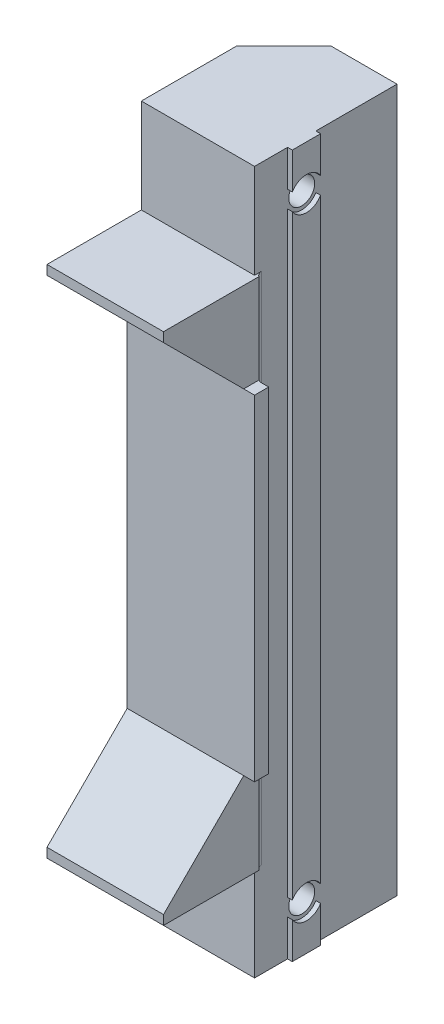
from build123d import *
from build123d.topology import SkipClean

# Parameters (mm, degrees)
BOSS_EXTRUDE1_DEPTH            = 7.2
SKETCH2_R                      = 1.1
CUT_EXTRUDE1_DEPTH             = 99.880748885
SKETCH3_R                      = 2.25
CUT_EXTRUDE2_DEPTH             = 5.5
BOSS_EXTRUDE2_DEPTH            = 3
FILLET1_R                      = 11
BOSS_EXTRUDE3_DEPTH            = 43
BOSS_EXTRUDE4_DEPTH            = 30
FILLET2_R                      = 1.5
SKETCH7_R                      = 2.75
CUT_EXTRUDE3_DEPTH             = 179.693144804
SKETCH8_R                      = 5.25
CUT_EXTRUDE4_DEPTH             = 5
CUT_EXTRUDE6_START             = -2.5
SKETCH10_R                     = 5.25
CUT_EXTRUDE6_DEPTH             = 2.5
CHAMFER1_SIZE                  = 2.5
CUT_EXTRUDE5_REACH             = 170.548
SKETCH9_R                      = 3.5
CUT_EXTRUDE5_DIRECTION_2_REACH = 170.548
CUT_EXTRUDE7_DEPTH             = 105.056727317
CUT_EXTRUDE8_DEPTH             = 20
BOSS_EXTRUDE6_DEPTH            = 17
SKETCH15_R                     = 5.25
BOSS_EXTRUDE7_DEPTH            = 10
CHAMFER3_SIZE                  = 10
BOSS_EXTRUDE5_DEPTH            = 17.55
SKETCH16_W                     = 1.5
SKETCH16_H                     = 19
CUT_EXTRUDE9_DEPTH             = 2.3
BOSS_EXTRUDE8_DEPTH            = 4
BOSS_EXTRUDE9_DEPTH            = 31.5


with BuildPart() as part:
    # Sketch1 → Boss-Extrude1 (new body)
    with BuildSketch(Plane.XY):
        Polygon((74.75, 0), (-74.75, 0), (-74.75, 30), (-88.75, 30), (-88.75, -13), (84.25, -13), (84.25, 17), (74.75, 17), align=None)
    extrude(amount=BOSS_EXTRUDE1_DEPTH)

    # Sketch2 → Cut-Extrude1 (cut, through all)
    with BuildSketch(Plane.XZ.offset(13)):
        with Locations(Location((-56.25, 4.5, 0), (0, 0, 270))):
            Circle(SKETCH2_R)
        with Locations(Location((37.75, 4.5, 0), (0, 0, 270))):
            Circle(SKETCH2_R)
    extrude(amount=-CUT_EXTRUDE1_DEPTH, mode=Mode.SUBTRACT)

    # Sketch3 → Cut-Extrude2 (cut)
    with BuildSketch(Plane.XZ.offset(13)):
        with Locations(Location((-56.25, 4.5, 0), (0, 0, 270))):
            Circle(SKETCH3_R)
        with Locations(Location((37.75, 4.5, 0), (0, 0, 270))):
            Circle(SKETCH3_R)
    extrude(amount=-CUT_EXTRUDE2_DEPTH, mode=Mode.SUBTRACT)

    # Sketch4 → Boss-Extrude2 (add)
    with BuildSketch(Plane.XY.offset(7.2)):
        Polygon((-88.75, -13), (84.25, -13), (84.25, 2.989373151), (84.25, 17), (74.75, 17), (74.75, 6), (-74.75, 6), (-74.75, 30), (-88.75, 30), align=None)
    extrude(amount=BOSS_EXTRUDE2_DEPTH)

    # Fillet1
    fillet1_edges = [part.edges().sort_by_distance(p)[0] for p in [
        (74.75, 6, 8.7),
        (-74.75, 6, 8.7),
    ]]
    fillet(fillet1_edges, radius=FILLET1_R - 0.0001)  # a hair under: the kernel refuses the full size

    # Sketch5 → Boss-Extrude3 (add)
    with BuildSketch(Plane.XZ.offset(13)):
        Polygon((-74.75, 30.2), (-71.75, 30.2), (-71.75, 33.2), (-88.75, 33.2), (-88.75, 10.2), (-74.75, 10.2), (-74.75, 17.2), (-73.75, 17.2), (-73.75, 23.2), (-74.75, 23.2), align=None)
    extrude(amount=-BOSS_EXTRUDE3_DEPTH)

    # Sketch6 → Boss-Extrude4 (add)
    with BuildSketch(Plane.XZ.offset(13)):
        Polygon((74.75, 10.2), (74.75, 17.2), (73.75, 17.2), (73.75, 23.2), (74.75, 23.2), (74.75, 30.2), (71.75, 30.2), (71.75, 33.2), (84.25, 33.2), (84.25, 10.2), align=None)
    extrude(amount=-BOSS_EXTRUDE4_DEPTH)

    # Fillet2
    fillet2_edges = [part.edges().sort_by_distance(p)[0] for p in [
        (74.75, 1.99995, 10.2),
        (74.75, 2, 30.2),
        (-74.75, 1.99995, 10.2),
        (-74.75, 8.5, 30.2),
    ]]
    fillet(fillet2_edges, radius=FILLET2_R)

    # Sketch7 → Cut-Extrude3 (cut, through all)
    with BuildSketch(Plane(origin=(84.25, 0, 0), x_dir=(0, 0, -1), z_dir=(1, 0, 0))):
        with Locations((-20.2, -3.5)):
            Circle(SKETCH7_R)
    extrude(amount=-CUT_EXTRUDE3_DEPTH, mode=Mode.SUBTRACT)

    # Sketch8 → Cut-Extrude4 (cut)
    with BuildSketch(Plane(origin=(84.25, 0, 0), x_dir=(0, 0, -1), z_dir=(1, 0, 0))):
        with Locations((-20.2, -3.5)):
            Circle(SKETCH8_R)
    extrude(amount=-CUT_EXTRUDE4_DEPTH, mode=Mode.SUBTRACT)

    # Sketch10 → Cut-Extrude6 (cut)
    with BuildSketch(Plane.ZY.offset(88.75).offset(CUT_EXTRUDE6_START)):
        with Locations(Location((20.2, -3.5, 0), (0, 0, 180))):
            Circle(SKETCH10_R)
    extrude(amount=CUT_EXTRUDE6_DEPTH, mode=Mode.SUBTRACT)

    # Chamfer1
    chamfer1_edges = [part.edges().sort_by_distance(p)[0] for p in [
        (79.25, -3.5, 22.95),
        (-86.25, -3.5, 22.95),
    ]]
    chamfer(chamfer1_edges, length=CHAMFER1_SIZE - 0.0001)  # a hair under: the kernel refuses the full size

    # Cut-Extrude5: up to this face of the body (flat: up to its plane)
    cut_extrude5_end = Plane(part.part.faces().sort_by_distance((74.75, 2, 25.95))[0])
    # Sketch9 → Cut-Extrude5 (cut, up to the picked face)
    with BuildSketch(Plane.ZY.offset(-73.75), mode=Mode.PRIVATE) as cut_extrude5_sk1:
        with Locations((20.2, -3.5)):
            Circle(SKETCH9_R)
    cut_extrude5_tool1 = split(extrude(cut_extrude5_sk1.sketch, amount=-CUT_EXTRUDE5_REACH, mode=Mode.PRIVATE), bisect_by=cut_extrude5_end, keep=Keep.BOTH, mode=Mode.PRIVATE)
    add(cut_extrude5_tool1.solids().sort_by(Axis((73.75, -3.5, 20.2), (1, 0, 0)))[0], mode=Mode.SUBTRACT)

    # Cut-Extrude5 direction 2: up to this face of the body (flat: up to its plane)
    cut_extrude5_direction_2_end = Plane(part.part.faces().sort_by_distance((-74.75, 8.5, 25.95))[0])
    # Sketch9 → Cut-Extrude5 direction 2 (cut, up to the picked face)
    with BuildSketch(Plane.ZY.offset(-73.75), mode=Mode.PRIVATE) as cut_extrude5_direction_2_sk1:
        with Locations((20.2, -3.5)):
            Circle(SKETCH9_R)
    cut_extrude5_direction_2_tool1 = split(extrude(cut_extrude5_direction_2_sk1.sketch, amount=CUT_EXTRUDE5_DIRECTION_2_REACH, mode=Mode.PRIVATE), bisect_by=cut_extrude5_direction_2_end, keep=Keep.BOTH, mode=Mode.PRIVATE)
    add(cut_extrude5_direction_2_tool1.solids().sort_by(Axis((73.75, -3.5, 20.2), (-1, 0, 0)))[0], mode=Mode.SUBTRACT)


with BuildPart() as body_2:
    # Mirror1: mirrored copy
    add(part.part.mirror(Plane(origin=(-88.75, -13, 7.2), x_dir=(0, 0, 1), z_dir=(0, 1, 0))))

    # Sketch11 → Cut-Extrude7 (cut, through all)
    with BuildSketch(Plane(origin=(0, -13, 0), x_dir=(1, 0, 0), z_dir=(0, 1, 0))):
        Polygon((71.75, -33.2), (71.75, -17.2), (-74.75, -17.2), (-74.75, 0), (71.75, 0), (84.25, 0), (84.25, -33.2), align=None)
    extrude(amount=-CUT_EXTRUDE7_DEPTH, mode=Mode.SUBTRACT)

    # Sketch13 → Cut-Extrude8 (cut)
    with BuildSketch(Plane(origin=(0, -13, 0), x_dir=(1, 0, 0), z_dir=(0, 1, 0))):
        Polygon((-88.75, -30.2), (-74.75, -30.2), (-74.75, -28.7), (-71.75, -28.7), (-71.75, -30.2), (-71.75, -33.2), (-88.75, -33.2), align=None)
    extrude(amount=-CUT_EXTRUDE8_DEPTH, mode=Mode.SUBTRACT)

    # Sketch14 → Boss-Extrude6 (add)
    with BuildSketch(Plane.ZY.offset(88.75)):
        Polygon((33.2, -33), (50.2, -33), (50.2, -35), (35.2, -50), (33.2, -52), (33.2, -50), align=None)
    extrude(amount=-BOSS_EXTRUDE6_DEPTH)

    # Sketch15 → Boss-Extrude7 (add)
    with SkipClean():  # the faces are left unmerged after this step: merging them gives an invalid solid
        with BuildSketch(Plane.ZY.offset(88.75)):
            Polygon((33.2, -52), (0, -52), (0, -13), (30.2, -13), (30.2, -33), (50.2, -33), (50.2, -35), align=None)
            with Locations((20.2, -22.5)):
                Circle(SKETCH15_R, mode=Mode.SUBTRACT)
        extrude(amount=BOSS_EXTRUDE7_DEPTH)
    add(body_2.part.scale(1), mode=Mode.REPLACE)  # the faces are merged on a copy

    # Chamfer3
    chamfer3_edges = [body_2.edges().sort_by_distance(p)[0] for p in [
        (-98.75, -32.5, 0),
    ]]
    chamfer(chamfer3_edges, length=CHAMFER3_SIZE)

    # Sketch12 → Boss-Extrude5 (add)
    with SkipClean():  # the faces are left unmerged after this step: merging them gives an invalid solid
        with BuildSketch(Plane.XZ.offset(56)):
            with BuildLine():
                Line((-88.75, 0), (-74.75, 0))
                Line((-74.75, 0), (-74.75, 17.2))
                Line((-74.75, 17.2), (-73.75, 17.2))
                Line((-73.75, 17.2), (-73.75, 23.2))
                Line((-73.75, 23.2), (-74.75, 23.2))
                Line((-74.75, 23.2), (-74.75, 28.7))
                ThreePointArc((-74.75, 28.7), (-74.310660172, 29.760660172), (-73.25, 30.2))
                Line((-73.25, 30.2), (-71.75, 30.2))
                Line((-71.75, 30.2), (-71.75, 33.2))
                Line((-71.75, 33.2), (-88.75, 33.2))
                Line((-88.75, 33.2), (-88.75, 0))
            make_face()
        extrude(amount=-BOSS_EXTRUDE5_DEPTH)

    # Sketch16 → Cut-Extrude9 (cut)
    with SkipClean():  # the faces are left unmerged after this step: merging them gives an invalid solid
        with BuildSketch(Plane(origin=(-71.75, 0, 0), x_dir=(0, 0, -1), z_dir=(1, 0, 0))):
            Polygon((-33.2, -52), (-30.2, -52), (-30.2, -33), (-50.2, -33), (-50.2, -35), align=None)
            with Locations((-29.45, -42.5)):
                Rectangle(SKETCH16_W, SKETCH16_H)
        extrude(amount=-CUT_EXTRUDE9_DEPTH, mode=Mode.SUBTRACT)

    # Sketch18 → Boss-Extrude8 (add)
    with SkipClean():  # the faces are left unmerged after this step: merging them gives an invalid solid
        with BuildSketch(Plane.XZ.offset(52)):
            Polygon((-98.75, 33.2), (-98.75, 10), (-88.75, 0), (-88.75, 33.2), align=None)
        extrude(amount=BOSS_EXTRUDE8_DEPTH)

    # Sketch19 → Boss-Extrude9 (add)
    with SkipClean():  # the faces are left unmerged after this step: merging them gives an invalid solid
        with BuildSketch(Plane.XZ.offset(56)):
            with BuildLine():
                Line((-88.75, 0), (-74.75, 0))
                Line((-74.75, 0), (-74.75, 17.2))
                Line((-74.75, 17.2), (-73.75, 17.2))
                Line((-73.75, 17.2), (-73.75, 23.2))
                Line((-73.75, 23.2), (-74.75, 23.2))
                Line((-74.75, 23.2), (-74.75, 28.7))
                ThreePointArc((-74.75, 28.7), (-74.310660172, 29.760660172), (-73.25, 30.2))
                Line((-73.25, 30.2), (-71.75, 30.2))
                Line((-71.75, 30.2), (-71.75, 33.2))
                Line((-71.75, 33.2), (-98.75, 33.2))
                Line((-98.75, 33.2), (-98.75, 10))
                Line((-98.75, 10), (-88.75, 0))
            make_face()
        extrude(amount=BOSS_EXTRUDE9_DEPTH)

    # Mirror2: body 2 across plane


with BuildPart() as body_2_1:
    with SkipClean():  # the faces are left unmerged after this step: merging them gives an invalid solid
        add(body_2.part)
        add(body_2.part.mirror(Plane.ZX.offset(-87.5)))


solid = body_2_1.part
